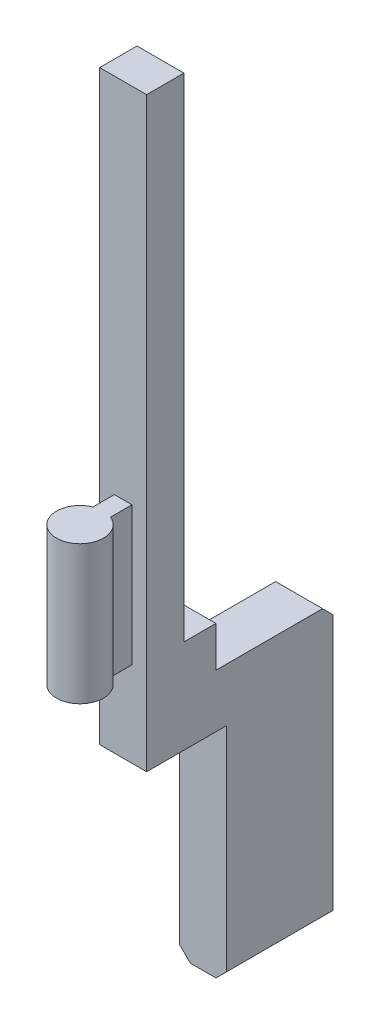
from build123d import *

# Parameters (mm, degrees)
SZKIC1_W                    = 4.4
SZKIC1_H                    = 21
DODANIE_WYCI_GNI_CIE1_DEPTH = 6.5
DODANIE_WYCI_GNI_CIE2_DEPTH = 13
SKETCH1_W                   = 4.4
SKETCH1_H                   = 5
BOSS_EXTRUDE1_DEPTH         = 11
SKETCH3_W                   = 4.4
SKETCH3_H                   = 10
BOSS_EXTRUDE3_DEPTH         = 21
CHAMFER1_SIZE               = 1
SKETCH5_W                   = 4.4
SKETCH5_H                   = 3
CUT_EXTRUDE1_DEPTH          = 12.2
SZKIC4_W                    = 4.4
SZKIC4_H                    = 3.5
DODANIE_WYCI_GNI_CIE3_DEPTH = 34


with BuildPart() as part:
    # Szkic1 → Dodanie-wyciągnięcie1 (new body)
    with BuildSketch(Plane.XY):
        Rectangle(SZKIC1_W, SZKIC1_H)
    extrude(amount=DODANIE_WYCI_GNI_CIE1_DEPTH)

    # Szkic3 → Dodanie-wyciągnięcie2 (add)
    with BuildSketch(Plane(origin=(0, 10.5, 0), x_dir=(1, 0, 0), z_dir=(0, 1, 0))):
        with BuildLine():
            Line((0.825, -8.510545416), (0.825, -6.5))
            Line((0.825, -6.5), (-0.825, -6.5))
            Line((-0.825, -6.5), (-0.825, -8.510545416))
            ThreePointArc((-0.825, -8.510545416), (0, -12.75), (0.825, -8.510545416))
        make_face()
    extrude(amount=-DODANIE_WYCI_GNI_CIE2_DEPTH)

    # Sketch1 → Boss-Extrude1 (add)
    with BuildSketch(Plane(origin=(0, 0, 0), x_dir=(-1, 0, 0), z_dir=(0, 0, -1))):
        with Locations((0, -8)):
            Rectangle(SKETCH1_W, SKETCH1_H)
    extrude(amount=BOSS_EXTRUDE1_DEPTH)

    # Sketch3 → Boss-Extrude3 (add)
    with BuildSketch(Plane.XZ.offset(10.5)):
        with Locations((0, -6)):
            Rectangle(SKETCH3_W, SKETCH3_H)
    extrude(amount=BOSS_EXTRUDE3_DEPTH)

    # Chamfer1
    chamfer1_edges = [part.edges().sort_by_distance(p)[0] for p in [
        (2.2, -31.5, -6),
        (-2.2, -31.5, -6),
        (0, -5.5, -11),
    ]]
    chamfer(chamfer1_edges, length=CHAMFER1_SIZE)

    # Sketch5 → Cut-Extrude1 (cut)
    with BuildSketch(Plane(origin=(0, 10.5, 0), x_dir=(1, 0, 0), z_dir=(0, 1, 0))):
        with Locations((0, -1.5)):
            Rectangle(SKETCH5_W, SKETCH5_H)
    extrude(amount=-CUT_EXTRUDE1_DEPTH, mode=Mode.SUBTRACT)

    # Szkic4 → Dodanie-wyciągnięcie3 (add)
    with BuildSketch(Plane(origin=(0, 10.5, 0), x_dir=(1, 0, 0), z_dir=(0, 1, 0))):
        with Locations((0, -4.75)):
            Rectangle(SZKIC4_W, SZKIC4_H)
    extrude(amount=DODANIE_WYCI_GNI_CIE3_DEPTH)


solid = part.part
